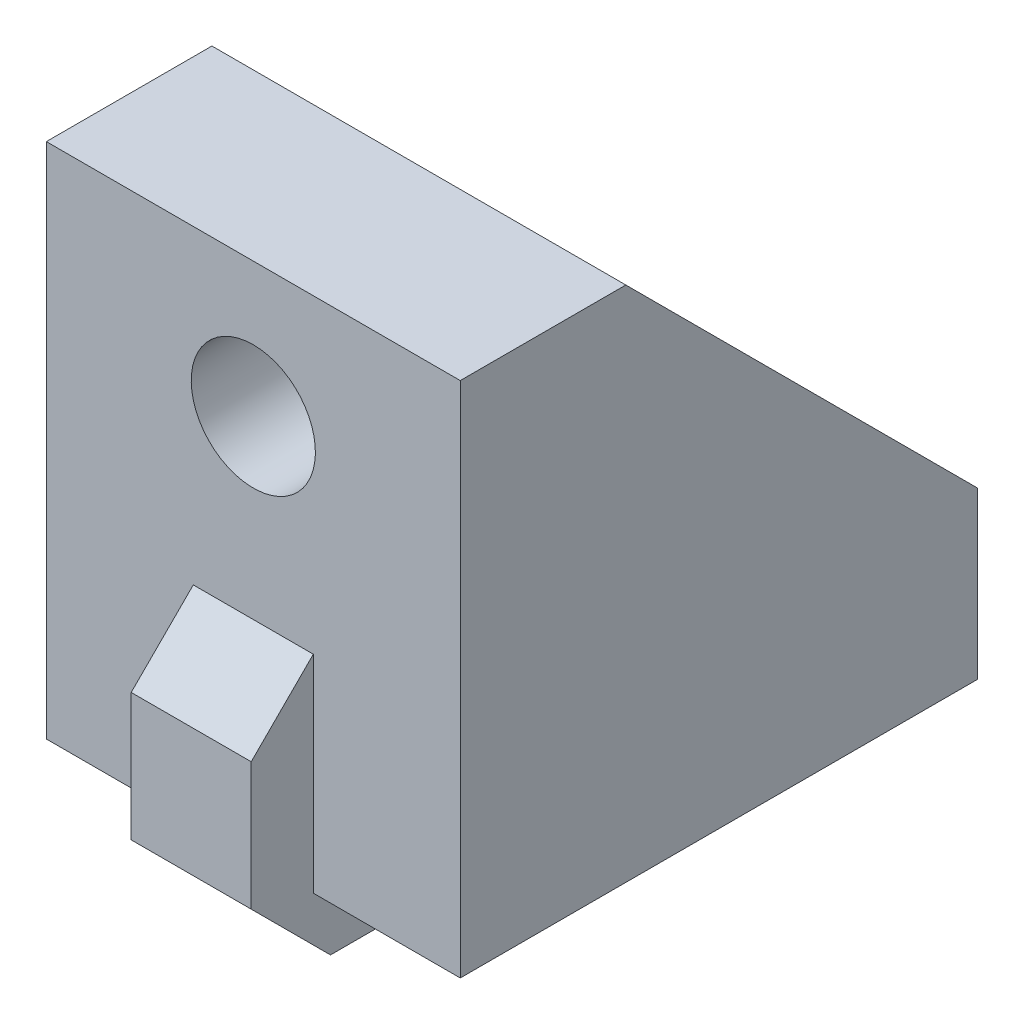
from build123d import *

# Parameters (mm, degrees)
BOSS_EXTRUDE1_DEPTH = 10
RIB18_REACH         = 36.641
SKETCH15_WALL_W     = 95.323662864
SKETCH15_WALL_H     = 4.5
RIB38_REACH         = 36.641
SKETCH17_WALL_W     = 95.323662864
SKETCH17_WALL_H     = 4.5
BOSS_EXTRUDE2_DEPTH = 2.9
SKETCH36_R          = 5.25
CUT_EXTRUDE4_DEPTH  = 1
SKETCH37_R          = 3
CUT_EXTRUDE5_DEPTH  = 8
SKETCH33_R          = 5.25
CUT_EXTRUDE1_DEPTH  = 1
SKETCH38_R          = 3
CUT_EXTRUDE6_DEPTH  = 8


with BuildPart() as part:
    # Sketch2 → Boss-Extrude1 (new, symmetric)
    with BuildSketch(Plane(origin=(0, 0, 0), x_dir=(0, 0, -1), z_dir=(1, 0, 0))):
        Polygon((-20, 5), (-12, 5), (-12, -12), (5, -12), (5, -20), (-20, -20), align=None)
    extrude(amount=BOSS_EXTRUDE1_DEPTH, both=True)

    # Sketch15 wall → Rib18 (add, up to next)
    with BuildSketch(Plane(origin=(10, -3.5, 3.5), x_dir=(0, -0.707106781187, -0.707106781187), z_dir=(0, 0.707106781187, -0.707106781187)), mode=Mode.PRIVATE) as rib18_sk1:
        with Locations((0, 2.25)):
            Rectangle(SKETCH15_WALL_W, SKETCH15_WALL_H)
    rib18_tool1 = extrude(rib18_sk1.sketch, amount=-RIB18_REACH, mode=Mode.PRIVATE) - part.part
    add(rib18_tool1.solids().sort_by_distance((10, -3.5, 3.5))[0])

    # Sketch17 wall → Rib38 (add, up to next)
    with BuildSketch(Plane(origin=(-10, -3.5, 3.5), x_dir=(0, -0.707106781187, -0.707106781187), z_dir=(0, -0.707106781187, 0.707106781187)), mode=Mode.PRIVATE) as rib38_sk1:
        with Locations((0, 2.25)):
            Rectangle(SKETCH17_WALL_W, SKETCH17_WALL_H)
    rib38_tool1 = extrude(rib38_sk1.sketch, amount=RIB38_REACH, mode=Mode.PRIVATE) - part.part
    add(rib38_tool1.solids().sort_by_distance((-10, -3.5, 3.5))[0])

    # Sketch31 → Boss-Extrude2 (add, symmetric)
    with BuildSketch(Plane(origin=(0, 0, 0), x_dir=(0, 0, -1), z_dir=(1, 0, 0))):
        Polygon((-20, -10), (-20, -20), (-10, -20), (-13, -23), (-19.170777974, -23), (-23, -19.170777974), (-23, -13), align=None)
    extrude(amount=BOSS_EXTRUDE2_DEPTH, both=True)

    # Sketch36 → Cut-Extrude4 (cut)
    with BuildSketch(Plane(origin=(0, 0, 12), x_dir=(-1, 0, 0), z_dir=(0, 0, -1))):
        with Locations((0, -1.5)):
            Circle(SKETCH36_R)
    extrude(amount=-CUT_EXTRUDE4_DEPTH, mode=Mode.SUBTRACT)

    # Sketch37 → Cut-Extrude5 (cut)
    with BuildSketch(Plane(origin=(0, 0, 13), x_dir=(-1, 0, 0), z_dir=(0, 0, -1))):
        with Locations((0, -1.5)):
            Circle(SKETCH37_R)
    extrude(amount=-CUT_EXTRUDE5_DEPTH, mode=Mode.SUBTRACT)

    # Sketch33 → Cut-Extrude1 (cut)
    with BuildSketch(Plane(origin=(0, -12, 0), x_dir=(1, 0, 0), z_dir=(0, 1, 0))):
        with Locations((0, -1.5)):
            Circle(SKETCH33_R)
    extrude(amount=-CUT_EXTRUDE1_DEPTH, mode=Mode.SUBTRACT)

    # Sketch38 → Cut-Extrude6 (cut)
    with BuildSketch(Plane(origin=(0, -13, 0), x_dir=(1, 0, 0), z_dir=(0, 1, 0))):
        with Locations((0, -1.5)):
            Circle(SKETCH38_R)
    extrude(amount=-CUT_EXTRUDE6_DEPTH, mode=Mode.SUBTRACT)


solid = part.part
